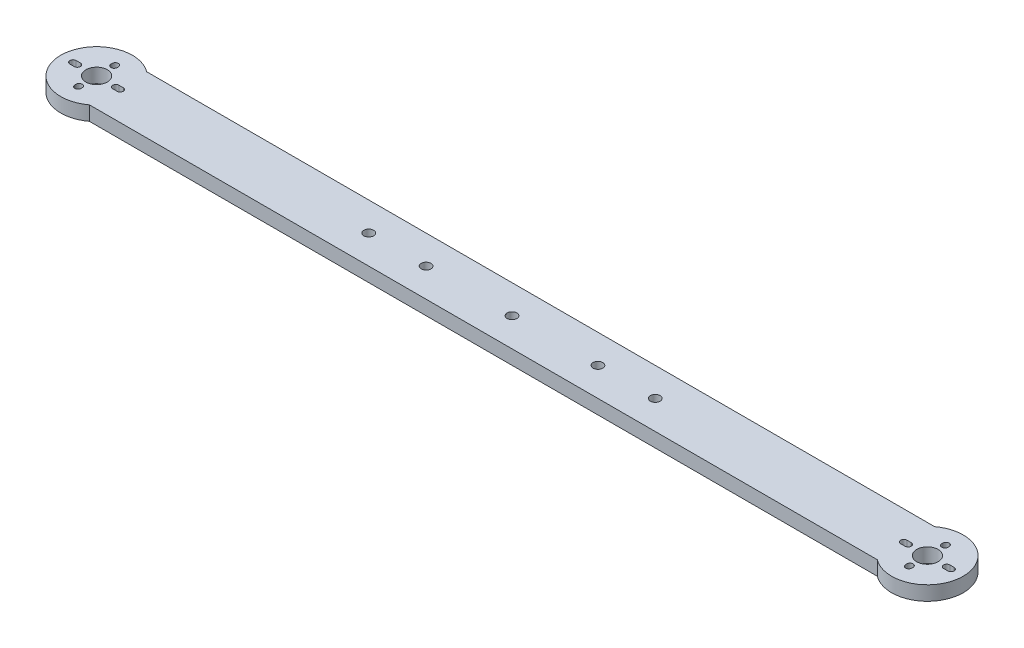
from build123d import *

# Parameters (mm, degrees)
BOSS_EXTRUDE1_DEPTH = 6.35
SKETCH2_R           = 4.75
CUT_EXTRUDE1_DEPTH  = 201.754423986
SKETCH3_R           = 2.159
CUT_EXTRUDE2_DEPTH  = 201.754423986
SKETCH4_R           = 2.159
CUT_EXTRUDE3_DEPTH  = 201.754423986


with BuildPart() as part:
    # Sketch1 → Boss-Extrude1 (new body)
    with BuildSketch(Plane(origin=(0, 0, 0), x_dir=(1, 0, 0), z_dir=(0, 1, 0))):
        with BuildLine():
            Line((-174.625, 12.7), (174.625, 12.7))
            ThreePointArc((174.625, 12.7), (200.025, 0), (174.625, -12.7))
            Line((174.625, -12.7), (-174.625, -12.7))
            ThreePointArc((-174.625, -12.7), (-200.025, 0), (-174.625, 12.7))
        make_face()
    extrude(amount=BOSS_EXTRUDE1_DEPTH)

    # Sketch2 → Cut-Extrude1 (cut, through all)
    with BuildSketch(Plane(origin=(0, 6.35, 0), x_dir=(1, 0, 0), z_dir=(0, 1, 0))):
        with Locations((184.15, 0)):
            Circle(SKETCH2_R)
        with Locations((-184.15, 0)):
            Circle(SKETCH2_R)
        with BuildLine():
            Line((173.691383345, 1.375), (175.608616655, 1.375))
            ThreePointArc((175.608616655, 1.375), (176.983616655, 0), (175.608616655, -1.375))
            Line((175.608616655, -1.375), (173.691383345, -1.375))
            ThreePointArc((173.691383345, -1.375), (172.316383345, 0), (173.691383345, 1.375))
        make_face()
        with BuildLine():
            Line((194.608616655, 1.375), (192.691383345, 1.375))
            ThreePointArc((192.691383345, 1.375), (191.316383345, 0), (192.691383345, -1.375))
            Line((192.691383345, -1.375), (194.608616655, -1.375))
            ThreePointArc((194.608616655, -1.375), (195.983616655, 0), (194.608616655, 1.375))
        make_face()
        with BuildLine():
            Line((185.525, 8.25), (185.525, 7.75))
            ThreePointArc((185.525, 7.75), (184.15, 6.375), (182.775, 7.75))
            Line((182.775, 7.75), (182.775, 8.25))
            ThreePointArc((182.775, 8.25), (184.15, 9.625), (185.525, 8.25))
        make_face()
        with BuildLine():
            Line((185.525, -8.25), (185.525, -7.75))
            ThreePointArc((185.525, -7.75), (184.15, -6.375), (182.775, -7.75))
            Line((182.775, -7.75), (182.775, -8.25))
            ThreePointArc((182.775, -8.25), (184.15, -9.625), (185.525, -8.25))
        make_face()
        with BuildLine():
            Line((-185.525, -8.25), (-185.525, -7.75))
            ThreePointArc((-185.525, -7.75), (-184.15, -6.375), (-182.775, -7.75))
            Line((-182.775, -7.75), (-182.775, -8.25))
            ThreePointArc((-182.775, -8.25), (-184.15, -9.625), (-185.525, -8.25))
        make_face()
        with BuildLine():
            Line((-185.525, 8.25), (-185.525, 7.75))
            ThreePointArc((-185.525, 7.75), (-184.15, 6.375), (-182.775, 7.75))
            Line((-182.775, 7.75), (-182.775, 8.25))
            ThreePointArc((-182.775, 8.25), (-184.15, 9.625), (-185.525, 8.25))
        make_face()
        with BuildLine():
            Line((-194.608616655, 1.375), (-192.691383345, 1.375))
            ThreePointArc((-192.691383345, 1.375), (-191.316383345, 0), (-192.691383345, -1.375))
            Line((-192.691383345, -1.375), (-194.608616655, -1.375))
            ThreePointArc((-194.608616655, -1.375), (-195.983616655, 0), (-194.608616655, 1.375))
        make_face()
        with BuildLine():
            Line((-173.691383345, 1.375), (-175.608616655, 1.375))
            ThreePointArc((-175.608616655, 1.375), (-176.983616655, 0), (-175.608616655, -1.375))
            Line((-175.608616655, -1.375), (-173.691383345, -1.375))
            ThreePointArc((-173.691383345, -1.375), (-172.316383345, 0), (-173.691383345, 1.375))
        make_face()
    extrude(amount=-CUT_EXTRUDE1_DEPTH, mode=Mode.SUBTRACT)

    # Sketch3 → Cut-Extrude2 (cut, through all)
    with BuildSketch(Plane(origin=(0, 6.35, 0), x_dir=(1, 0, 0), z_dir=(0, 1, 0))):
        Circle(SKETCH3_R)
        with Locations((38.1, 0)):
            Circle(SKETCH3_R)
        with Locations((-38.1, 0)):
            Circle(SKETCH3_R)
    extrude(amount=-CUT_EXTRUDE2_DEPTH, mode=Mode.SUBTRACT)

    # Sketch4 → Cut-Extrude3 (cut, through all)
    with BuildSketch(Plane(origin=(0, 6.35, 0), x_dir=(1, 0, 0), z_dir=(0, 1, 0))):
        with Locations((63.5, 0)):
            Circle(SKETCH4_R)
        with Locations((-63.5, 0)):
            Circle(SKETCH4_R)
    extrude(amount=-CUT_EXTRUDE3_DEPTH, mode=Mode.SUBTRACT)


solid = part.part
